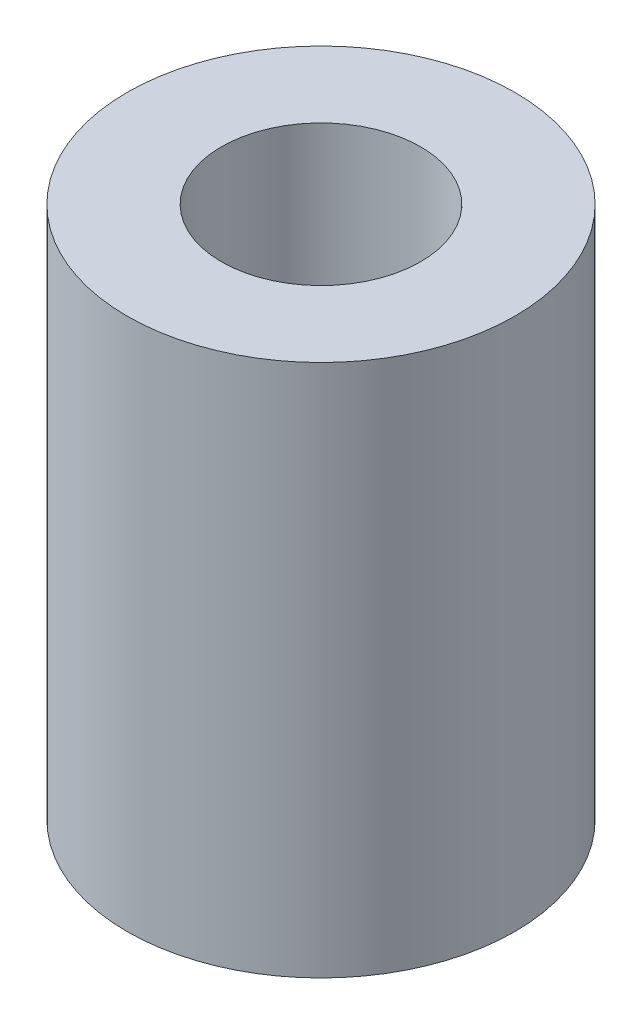
from build123d import *

# Parameters (mm, degrees)
SKETCH1_R           = 6.35
SKETCH1_R_2         = 3.2639
BOSS_EXTRUDE1_DEPTH = 17.4625


with BuildPart() as part:
    # Sketch1 → Boss-Extrude1 (new body)
    with BuildSketch(Plane(origin=(0, 0, 0), x_dir=(1, 0, 0), z_dir=(0, 1, 0))):
        Circle(SKETCH1_R)
        Circle(SKETCH1_R_2, mode=Mode.SUBTRACT)
    extrude(amount=BOSS_EXTRUDE1_DEPTH)


solid = part.part
